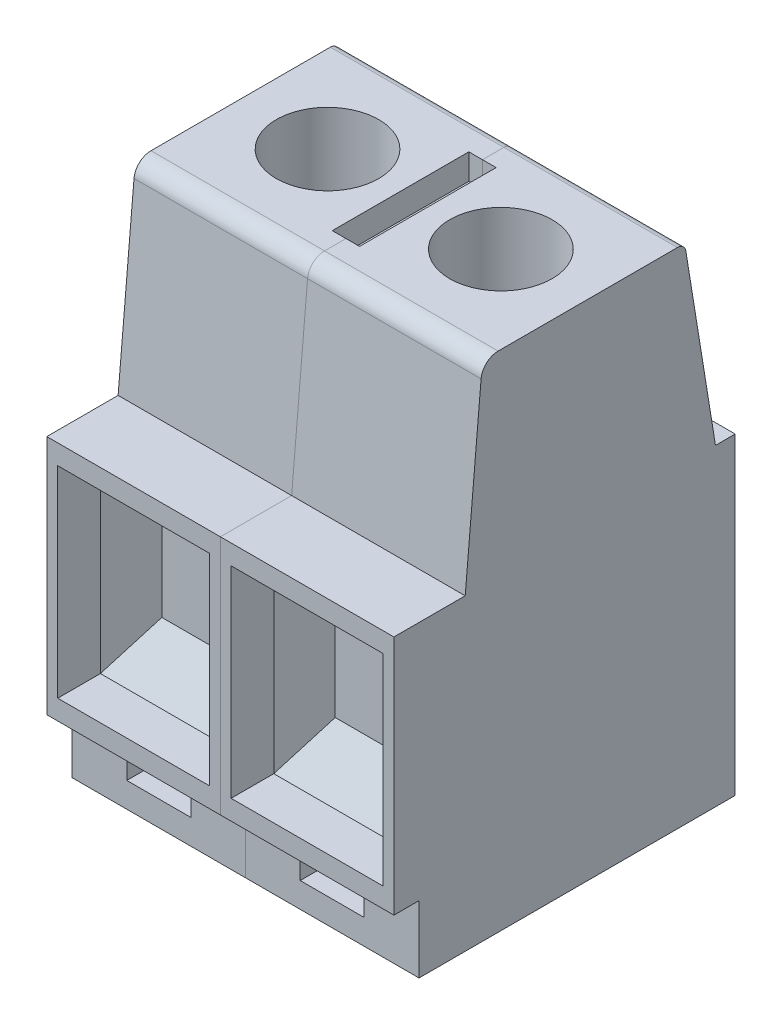
from build123d import *

# Parameters (mm, degrees)
BOSS_EXTRUDE1_DEPTH   = 10.16
SKETCH2_W             = 8.9
SKETCH2_H             = 11.8
CUT_EXTRUDE1_DEPTH    = 2.5
FILLET1_R             = 0.5
FILLET2_R             = 1
SKETCH5_R             = 3
CUT_EXTRUDE2_DEPTH    = 5.7
SKETCH7_W             = 1.3
SKETCH7_H             = 0.8
BOSS_EXTRUDE2_DEPTH   = 4.5
CUT_EXTRUDE5_START    = -10.96
CUT_EXTRUDE5_DEPTH    = 10.96
SKETCH10_R            = 1.5
CUT_EXTRUDE6_DEPTH    = 4.5
SKETCH13_W            = 3.75
SKETCH13_H            = 1
CUT_EXTRUDE8_DEPTH    = 3
SKETCH11_W            = 1.6
SKETCH11_H            = 8
CUT_EXTRUDE7_DEPTH    = 1.5
SKETCH12_W            = 1.3
SKETCH12_H            = 1.3
BOSS_EXTRUDE3_DEPTH   = 0.5
BOSS_EXTRUDE3_2_DEPTH = 0.5
BOSS_EXTRUDE3_3_DEPTH = 0.5
BOSS_EXTRUDE4_START   = 0.01
BOSS_EXTRUDE4_DEPTH   = 0.01
BOSS_EXTRUDE5_DEPTH   = 0.01


# Read off the part's stored shape, not the designer's step: Cut-Extrude5
with BuildPart() as part:
    # Sketch1 → Boss-Extrude1 (new body)
    with BuildSketch(Plane(origin=(0, 0, 0), x_dir=(0, 0, -1), z_dir=(1, 0, 0))):
        Polygon((9.66921347, 32.969152597), (9.66921347, 47.086783372), (13.84750154, 47.086783372), (14.859335014, 58.541856165), (26.70903057, 58.541856165), (28.514863985, 47.386490611), (29.66921347, 47.386490611), (29.66921347, 29.041856165), (11.142277404, 29.041856165), (11.142277404, 32.969152597), align=None)
    extrude(amount=BOSS_EXTRUDE1_DEPTH)

    # Sketch2 → Cut-Extrude1 (cut)
    with BuildSketch(Plane.XY.offset(-9.66921347)):
        with Locations((5.08, 40.027967985)):
            Rectangle(SKETCH2_W, SKETCH2_H)
    extrude(amount=-CUT_EXTRUDE1_DEPTH, mode=Mode.SUBTRACT)

    # Sketch3 → Cut-Loft1 section 0
    with BuildSketch(Plane.XY.offset(-12.16921347)):
        with BuildLine():
            Line((9.53, 34.127967985), (9.53, 45.927967985))
            Line((9.53, 45.927967985), (0.63, 45.927967985))
            Line((0.63, 45.927967985), (0.63, 34.127967985))
            Line((0.63, 34.127967985), (9.53, 34.127967985))
        make_face()
    # Sketch4 → Cut-Loft1 section 1
    with BuildSketch(Plane.XY.offset(-14.06921347)):
        with BuildLine():
            Line((2.33, 36.877967985), (7.83, 36.877967985))
            Line((7.83, 36.877967985), (7.83, 43.177967985))
            Line((7.83, 43.177967985), (2.33, 43.177967985))
            Line((2.33, 43.177967985), (2.33, 36.877967985))
        make_face()
    loft(mode=Mode.SUBTRACT)

    # Fillet1
    fillet1_edges = [part.edges().sort_by_distance(p)[0] for p in [
        (5.08, 58.541856165, -26.70903057),
    ]]
    fillet(fillet1_edges, radius=FILLET1_R)

    # Fillet2
    fillet2_edges = [part.edges().sort_by_distance(p)[0] for p in [
        (5.08, 58.541856165, -14.859335014),
    ]]
    fillet(fillet2_edges, radius=FILLET2_R)

    # Sketch5 → Cut-Extrude2 (cut)
    with BuildSketch(Plane(origin=(0, 58.541856165, 0), x_dir=(1, 0, 0), z_dir=(0, 1, 0))):
        with Locations(Location((5.08, 21.02917987, 0), (0, 0, 270))):
            Circle(SKETCH5_R)
    extrude(amount=-CUT_EXTRUDE2_DEPTH, mode=Mode.SUBTRACT)

    # Sketch7 → Boss-Extrude2 (add)
    with BuildSketch(Plane.XZ.offset(-29.041856165)):
        with Locations((5.08, -27.16921347)):
            Rectangle(SKETCH7_W, SKETCH7_H)
        with Locations((5.08, -17.00921347)):
            Rectangle(SKETCH7_W, SKETCH7_H)
    extrude(amount=BOSS_EXTRUDE2_DEPTH)

    # Cut-Extrude5 outline → Cut-Extrude5 (cut)
    with BuildSketch(Plane.XY.offset(-16.60921347).offset(CUT_EXTRUDE5_START)):
        with BuildLine():
            Line((5.73, 24.541856165), (5.73, 25.191856165))
            ThreePointArc((5.73, 25.191856165), (5.539619408, 24.732236757), (5.08, 24.541856165))
            Line((5.08, 24.541856165), (5.73, 24.541856165))
        make_face()
        with BuildLine():
            Line((4.43, 24.541856165), (5.08, 24.541856165))
            ThreePointArc((5.08, 24.541856165), (4.620380592, 24.732236757), (4.43, 25.191856165))
            Line((4.43, 25.191856165), (4.43, 24.541856165))
        make_face()
    extrude(amount=CUT_EXTRUDE5_DEPTH, mode=Mode.SUBTRACT)

    # Sketch10 → Cut-Extrude6 (cut)
    with BuildSketch(Plane(origin=(0, 38.527852041, -38.527852041), x_dir=(-1, 0, 0), z_dir=(0, 0.7071067811865488, -0.7071067811865464))):
        with Locations(Location((-5.08, 12.52800681, 0), (0, 0, 90))):
            Circle(SKETCH10_R)
    extrude(amount=-CUT_EXTRUDE6_DEPTH, mode=Mode.SUBTRACT)

    # Sketch13 → Cut-Extrude8 (cut)
    with BuildSketch(Plane.XY.offset(-11.142277404)):
        with Locations((5.08, 31.005504381)):
            Rectangle(SKETCH13_W, SKETCH13_H)
    extrude(amount=-CUT_EXTRUDE8_DEPTH, mode=Mode.SUBTRACT)


with BuildPart() as body_2:
    # Mirror2: mirrored copy
    add(part.part.mirror(Plane.ZY))


with BuildPart() as cut_extrude7_tool:
    # Sketch11 → Cut-Extrude7 (new body)
    with BuildSketch(Plane(origin=(0, 58.541856165, 0), x_dir=(1, 0, 0), z_dir=(0, 1, 0))):
        with Locations((0, 21.02917987)):
            Rectangle(SKETCH11_W, SKETCH11_H)
    extrude(amount=-CUT_EXTRUDE7_DEPTH)


with BuildPart() as part_1:
    add(part.part)

    # Cut-Extrude7: cut by cut_extrude7_tool
    add(cut_extrude7_tool.part, mode=Mode.SUBTRACT)

    # Sketch14 → Boss-Extrude4 (add)
    with BuildSketch(Plane(origin=(10.16, 0, 0), x_dir=(0, 0, -1), z_dir=(1, 0, 0)).offset(BOSS_EXTRUDE4_START)):
        with BuildLine():
            Line((26.28346176, 58.541856165), (15.77489798, 58.541856165))
            ThreePointArc((15.77489798, 58.541856165), (15.099615822, 58.279415659), (14.778776447, 57.629844179))
            Line((14.778776447, 57.629844179), (13.84750154, 47.086783372))
            Line((13.84750154, 47.086783372), (9.66921347, 47.086783372))
            Line((9.66921347, 47.086783372), (9.66921347, 32.969152597))
            Line((9.66921347, 32.969152597), (11.142277404, 32.969152597))
            Line((11.142277404, 32.969152597), (11.142277404, 29.041856165))
            Line((11.142277404, 29.041856165), (29.66921347, 29.041856165))
            Line((29.66921347, 29.041856165), (29.66921347, 47.386490611))
            Line((29.66921347, 47.386490611), (28.514863985, 47.386490611))
            Line((28.514863985, 47.386490611), (26.777036465, 58.121756163))
            ThreePointArc((26.777036465, 58.121756163), (26.607537368, 58.422611991), (26.28346176, 58.541856165))
        make_face()
    extrude(amount=-BOSS_EXTRUDE4_DEPTH)


with BuildPart() as body_2_1:
    add(body_2.part)

    # Cut-Extrude7: cut by cut_extrude7_tool
    add(cut_extrude7_tool.part, mode=Mode.SUBTRACT)

    # Sketch15 → Boss-Extrude5 (add)
    with BuildSketch(Plane.ZY.offset(10.16)):
        with BuildLine():
            Line((-15.77489798, 58.541856165), (-26.28346176, 58.541856165))
            ThreePointArc((-26.28346176, 58.541856165), (-26.607537368, 58.422611991), (-26.777036465, 58.121756163))
            Line((-26.777036465, 58.121756163), (-28.514863985, 47.386490611))
            Line((-28.514863985, 47.386490611), (-29.66921347, 47.386490611))
            Line((-29.66921347, 47.386490611), (-29.66921347, 29.041856165))
            Line((-29.66921347, 29.041856165), (-11.142277404, 29.041856165))
            Line((-11.142277404, 29.041856165), (-11.142277404, 32.969152597))
            Line((-11.142277404, 32.969152597), (-9.66921347, 32.969152597))
            Line((-9.66921347, 32.969152597), (-9.66921347, 47.086783372))
            Line((-9.66921347, 47.086783372), (-13.84750154, 47.086783372))
            Line((-13.84750154, 47.086783372), (-14.778776447, 57.629844179))
            ThreePointArc((-14.778776447, 57.629844179), (-15.099615822, 58.279415659), (-15.77489798, 58.541856165))
        make_face()
    extrude(amount=BOSS_EXTRUDE5_DEPTH)


with BuildPart() as body_3:
    # Sketch12 → Boss-Extrude3 (new body)
    with BuildSketch(Plane.XZ.offset(-29.041856165)):
        with Locations((0, -15.192277404)):
            Rectangle(SKETCH12_W, SKETCH12_H)
    extrude(amount=BOSS_EXTRUDE3_DEPTH)


with BuildPart() as body_4:
    # Sketch12 → Boss-Extrude3 2 (new body)
    with BuildSketch(Plane.XZ.offset(-29.041856165)):
        with Locations((0, -19.692277404)):
            Rectangle(SKETCH12_W, SKETCH12_H)
    extrude(amount=BOSS_EXTRUDE3_2_DEPTH)


with BuildPart() as body_5:
    # Sketch12 → Boss-Extrude3 3 (new body)
    with BuildSketch(Plane.XZ.offset(-29.041856165)):
        with Locations((0, -24.392277404)):
            Rectangle(SKETCH12_W, SKETCH12_H)
    extrude(amount=BOSS_EXTRUDE3_3_DEPTH)


solid = Compound([part_1.part, body_2_1.part, body_3.part, body_4.part, body_5.part])
